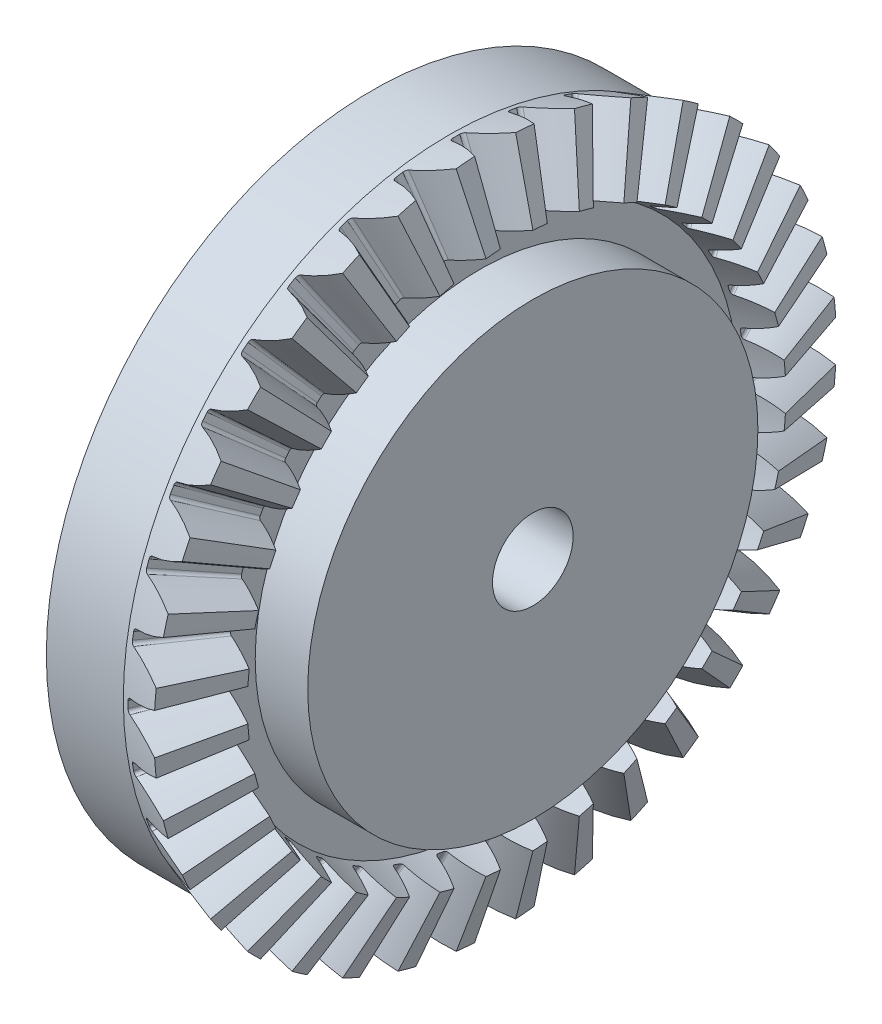
from build123d import *

# Parameters (mm, degrees)
TOOCUTSKE2_R    = 0.0127
TEETHCUTS_COUNT = 36
TEETHCUTS_ANGLE = 350
SKETCH_1_R      = 6
EXTRUDE_1_DEPTH = 1.4
HUBSKE_R        = 8.683991837
HUB_DEPTH       = 2.05207711
BORSKE_R        = 1.075
BORE_DEPTH      = 6.0000508


with BuildPart() as part:
    # BasProSke → Base-Revolve (revolve)
    with BuildSketch(Plane(origin=(0, 0, 0), x_dir=(1, 0, 0), z_dir=(0, 1, 0)), mode=Mode.PRIVATE) as base_revolve_sk:
        Polygon((0, 0), (0, 8.683991838), (1.22841311, 9.093462873), (1.801757528, 7.176392572), (0.832316641, 6.853245611), (0.832316641, 0), align=None)
    revolve(base_revolve_sk.sketch.rotate(Axis((-10, 0, 0), (1, 0, 0)), 180), axis=Axis((-10, 0, 0), (1, 0, 0)))

    # TooCutSke2 → ToothCut section 0
    with BuildSketch(Plane(origin=(0.394802446, -1.184407343, 0), x_dir=(0, 0, 1), z_dir=(-0.31622776466284125, 0.9486832985018461, 0))):
        with Locations((0, 3.745424883)):
            Circle(TOOCUTSKE2_R)
    # TooCutSke → ToothCut section 1
    with BuildSketch(Plane(origin=(0.614206555, 8.888727355, 0), x_dir=(0, 0, -1), z_dir=(-0.31622776466284125, 0.9486832985018461, 0))):
        with BuildLine():
            ThreePointArc((-0.64415232, -0.811435135), (0, -0.833341667), (0.64415232, -0.811435135))
            ThreePointArc((0.64415232, -0.811435135), (0.36379195, -0.240362289), (0.188332762, 0.371144215))
            ThreePointArc((0.188332762, 0.371144215), (0.15510405, 0.426732334), (0.093970814, 0.448107872))
            ThreePointArc((0.093970814, 0.448107872), (0, 0.447569444), (-0.093970814, 0.448107872))
            ThreePointArc((-0.093970814, 0.448107872), (-0.15510405, 0.426732334), (-0.188332762, 0.371144215))
            ThreePointArc((-0.188332762, 0.371144215), (-0.36379195, -0.240362289), (-0.64415232, -0.811435135))
        make_face()
    toothcut = loft(mode=Mode.SUBTRACT)

    # TeethCuts: ToothCut ×36 about axis
    teethcuts_axis = Axis((-10, 0, 0), (1, 0, 0))
    for i in range(1, TEETHCUTS_COUNT):
        add(toothcut.rotate(teethcuts_axis, i * TEETHCUTS_ANGLE / (TEETHCUTS_COUNT - 1)), mode=Mode.SUBTRACT)

    # 草图1 → 凸台-拉伸1 (add)
    with BuildSketch(Plane(origin=(0.832316641, 0, 0), x_dir=(0, 0, -1), z_dir=(1, 0, 0))):
        with Locations(Location((0, 0, 0), (0, 0, 180))):
            Circle(SKETCH_1_R)
    extrude(amount=EXTRUDE_1_DEPTH)

    # HubSke → Hub (add)
    with BuildSketch(Plane.ZY):
        Circle(HUBSKE_R)
    extrude(amount=HUB_DEPTH)

    # BorSke → Bore (cut, symmetric)
    with BuildSketch(Plane(origin=(0, 0, 0), x_dir=(0, 0, -1), z_dir=(1, 0, 0))):
        with Locations(Location((0, 0, 0), (0, 0, 180))):
            Circle(BORSKE_R)
    extrude(amount=BORE_DEPTH, both=True, mode=Mode.SUBTRACT)


solid = part.part
